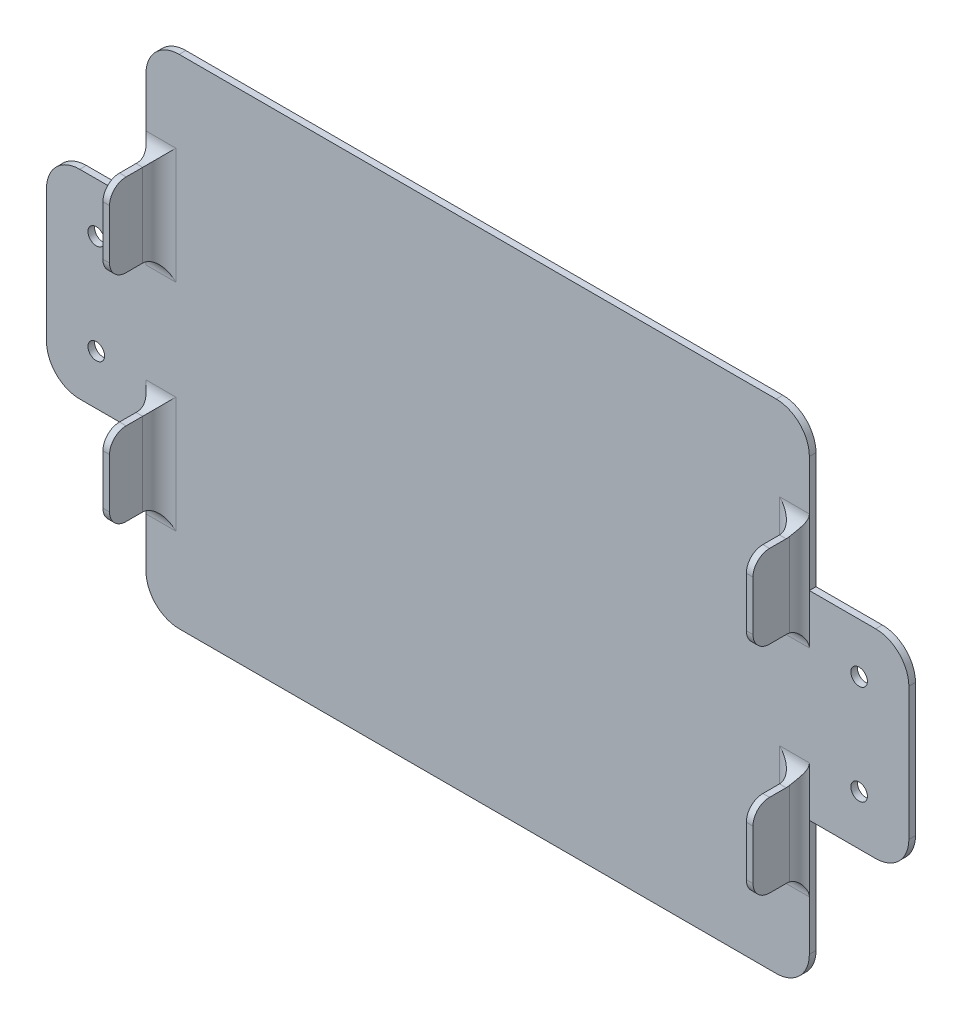
from build123d import *

# Parameters (mm, degrees)
ESQUISSE1_W             = 200
ESQUISSE1_H             = 150
BOSS_EXTRU_1_DEPTH      = 2
CONG_1_R                = 10
ESQUISSE2_W             = 2
ESQUISSE2_H             = 25
BOSS_EXTRU_2_DEPTH      = 15
CONG_2_R                = 5
ESQUISSE3_W             = 4.5
ESQUISSE3_H             = 30
ENL_V_MAT_EXTRU_1_DEPTH = 15
ESQUISSE4_R             = 2.5
BOSS_EXTRU_3_DEPTH      = 2


with BuildPart() as part:
    # Esquisse1 → Boss.-Extru.1 (new body)
    with BuildSketch(Plane.XY):
        with Locations((100, 75)):
            Rectangle(ESQUISSE1_W, ESQUISSE1_H)
    extrude(amount=BOSS_EXTRU_1_DEPTH)

    # Congé1
    cong_1_edges = [part.edges().sort_by_distance(p)[0] for p in [
        (0, 150, 1),
        (200, 150, 1),
        (200, 0, 1),
        (0, 0, 1),
    ]]
    fillet(cong_1_edges, radius=CONG_1_R)

    # Esquisse2 → Boss.-Extru.2 (add)
    with BuildSketch(Plane.XY.offset(2)):
        with Locations((3, 107.5)):
            Rectangle(ESQUISSE2_W, ESQUISSE2_H)
        with Locations((3, 42.5)):
            Rectangle(ESQUISSE2_W, ESQUISSE2_H)
        with Locations((197, 42.5)):
            Rectangle(ESQUISSE2_W, ESQUISSE2_H)
        with Locations((197, 107.5)):
            Rectangle(ESQUISSE2_W, ESQUISSE2_H)
    extrude(amount=BOSS_EXTRU_2_DEPTH)

    # Congé2
    # the kernel refuses this fillet: 5 mm, written as the material it adds along each edge
    with BuildSketch(Plane(origin=(2, 30, 2), x_dir=(-1, 0, 0), z_dir=(0, 1, 0)), Plane(origin=(2, 95, 2), x_dir=(-1, 0, 0), z_dir=(0, 1, 0))) as cong_2_piece_1:
        with BuildLine():
            CenterArc((5, 4), CONG_2_R, 180, 53.130102354)
            Line((0, 4), (0, 0))
            Line((0, 0), (2, 0))
        make_face()
    extrude(amount=25)
    with BuildSketch(Plane(origin=(4, 30, 2), x_dir=(0, -1, 0), z_dir=(-1, 0, 0)), Plane(origin=(2, 55, 2), x_dir=(0, 1, 0), z_dir=(1, 0, 0)), Plane(origin=(4, 95, 2), x_dir=(0, -1, 0), z_dir=(-1, 0, 0)), Plane(origin=(2, 120, 2), x_dir=(0, 1, 0), z_dir=(1, 0, 0))) as cong_2_piece_2:
        with BuildLine():
            CenterArc((CONG_2_R, CONG_2_R), CONG_2_R, 180, 90)
            Line((0, CONG_2_R), (0, 0))
            Line((0, 0), (CONG_2_R, 0))
        make_face()
    extrude(amount=2)
    with BuildSketch(Plane(origin=(4, 55, 2), x_dir=(1, 0, 0), z_dir=(0, -1, 0)), Plane(origin=(4, 120, 2), x_dir=(1, 0, 0), z_dir=(0, -1, 0))) as cong_2_piece_3:
        with BuildLine():
            CenterArc((CONG_2_R, CONG_2_R), CONG_2_R, 180, 90)
            Line((0, CONG_2_R), (0, 0))
            Line((0, 0), (CONG_2_R, 0))
        make_face()
    extrude(amount=25)
    with BuildSketch(Plane(origin=(198, 95, 2), x_dir=(1, 0, 0), z_dir=(0, 1, 0)), Plane(origin=(198, 30, 2), x_dir=(1, 0, 0), z_dir=(0, 1, 0))) as cong_2_piece_4:
        with BuildLine():
            CenterArc((5, -4), CONG_2_R, 126.869897646, 53.130102354)
            Line((0, -4), (0, 0))
            Line((0, 0), (2, 0))
        make_face()
    extrude(amount=25)
    with BuildSketch(Plane(origin=(198, 120, 2), x_dir=(0, 1, 0), z_dir=(-1, 0, 0)), Plane(origin=(196, 95, 2), x_dir=(0, -1, 0), z_dir=(1, 0, 0)), Plane(origin=(196, 30, 2), x_dir=(0, -1, 0), z_dir=(1, 0, 0)), Plane(origin=(198, 55, 2), x_dir=(0, 1, 0), z_dir=(-1, 0, 0))) as cong_2_piece_5:
        with BuildLine():
            CenterArc((CONG_2_R, -CONG_2_R), CONG_2_R, 90, 90)
            Line((0, -CONG_2_R), (0, 0))
            Line((0, 0), (CONG_2_R, 0))
        make_face()
    extrude(amount=2)
    with BuildSketch(Plane(origin=(196, 120, 2), x_dir=(-1, 0, 0), z_dir=(0, -1, 0)), Plane(origin=(196, 55, 2), x_dir=(-1, 0, 0), z_dir=(0, -1, 0))) as cong_2_piece_6:
        with BuildLine():
            CenterArc((CONG_2_R, -CONG_2_R), CONG_2_R, 90, 90)
            Line((0, -CONG_2_R), (0, 0))
            Line((0, 0), (CONG_2_R, 0))
        make_face()
    extrude(amount=25)
    with BuildSketch(Plane(origin=(2, 20, 2), x_dir=(-1, 0, 0), z_dir=(0, 1, 0))) as cong_2_piece_7a_section:
        with BuildLine():
            CenterArc((5, 4), CONG_2_R, 180, 53.130102354)
            Line((0, 4), (0, 0))
            Line((0, 0), (2, 0))
        make_face()
    cong_2_piece_7a = extrude(amount=35, mode=Mode.PRIVATE)
    cong_2_piece_7a = split(cong_2_piece_7a, bisect_by=Plane(origin=(2, 30, 2), z_dir=(0, -1, 0)), keep=Keep.TOP, mode=Mode.PRIVATE)
    with BuildSketch(Plane(origin=(4, 30, 2), x_dir=(0, -1, 0), z_dir=(-1, 0, 0))) as cong_2_piece_7b_section:
        with BuildLine():
            CenterArc((CONG_2_R, CONG_2_R), CONG_2_R, 180, 90)
            Line((0, CONG_2_R), (0, 0))
            Line((0, 0), (CONG_2_R, 0))
        make_face()
    cong_2_piece_7b = extrude(amount=14.5, mode=Mode.PRIVATE)
    cong_2_piece_7b = split(cong_2_piece_7b, bisect_by=Plane(origin=(0, 30, 2), z_dir=(1, 0, 0)), keep=Keep.TOP, mode=Mode.PRIVATE)
    cong_2_piece_7b = split(cong_2_piece_7b, bisect_by=Plane(origin=(2, 30, 2), z_dir=(-1, 0, 0)), keep=Keep.TOP, mode=Mode.PRIVATE)
    cong_2_piece_7 = cong_2_piece_7a & cong_2_piece_7b
    add(cong_2_piece_7)
    with BuildSketch(Plane(origin=(2, 30, 2), x_dir=(-1, 0, 0), z_dir=(0, 1, 0))) as cong_2_piece_8a_section:
        with BuildLine():
            CenterArc((5, 4), CONG_2_R, 180, 53.130102354)
            Line((0, 4), (0, 0))
            Line((0, 0), (2, 0))
        make_face()
    cong_2_piece_8a = extrude(amount=35, mode=Mode.PRIVATE)
    cong_2_piece_8a = split(cong_2_piece_8a, bisect_by=Plane(origin=(2, 55, 2), z_dir=(0, 1, 0)), keep=Keep.TOP, mode=Mode.PRIVATE)
    with BuildSketch(Plane(origin=(-10.5, 55, 2), x_dir=(0, 1, 0), z_dir=(1, 0, 0))) as cong_2_piece_8b_section:
        with BuildLine():
            CenterArc((CONG_2_R, CONG_2_R), CONG_2_R, 180, 90)
            Line((0, CONG_2_R), (0, 0))
            Line((0, 0), (CONG_2_R, 0))
        make_face()
    cong_2_piece_8b = extrude(amount=14.5, mode=Mode.PRIVATE)
    cong_2_piece_8b = split(cong_2_piece_8b, bisect_by=Plane(origin=(0, 55, 2), z_dir=(1, 0, 0)), keep=Keep.TOP, mode=Mode.PRIVATE)
    cong_2_piece_8b = split(cong_2_piece_8b, bisect_by=Plane(origin=(2, 55, 2), z_dir=(-1, 0, 0)), keep=Keep.TOP, mode=Mode.PRIVATE)
    cong_2_piece_8 = cong_2_piece_8a & cong_2_piece_8b
    add(cong_2_piece_8)
    with BuildSketch(Plane(origin=(16.5, 30, 2), x_dir=(0, -1, 0), z_dir=(-1, 0, 0))) as cong_2_piece_9a_section:
        with BuildLine():
            CenterArc((CONG_2_R, CONG_2_R), CONG_2_R, 180, 90)
            Line((0, CONG_2_R), (0, 0))
            Line((0, 0), (CONG_2_R, 0))
        make_face()
    cong_2_piece_9a = extrude(amount=14.5, mode=Mode.PRIVATE)
    cong_2_piece_9a = split(cong_2_piece_9a, bisect_by=Plane(origin=(4, 30, 2), z_dir=(1, 0, 0)), keep=Keep.TOP, mode=Mode.PRIVATE)
    with BuildSketch(Plane(origin=(4, 55, 2), x_dir=(1, 0, 0), z_dir=(0, -1, 0))) as cong_2_piece_9b_section:
        with BuildLine():
            CenterArc((CONG_2_R, CONG_2_R), CONG_2_R, 180, 90)
            Line((0, CONG_2_R), (0, 0))
            Line((0, 0), (CONG_2_R, 0))
        make_face()
    cong_2_piece_9b = extrude(amount=37.5, mode=Mode.PRIVATE)
    cong_2_piece_9b = split(cong_2_piece_9b, bisect_by=Plane(origin=(4, 30, 2), z_dir=(0, -1, 0)), keep=Keep.TOP, mode=Mode.PRIVATE)
    cong_2_piece_9 = cong_2_piece_9a & cong_2_piece_9b
    add(cong_2_piece_9)
    with BuildSketch(Plane(origin=(4, 67.5, 2), x_dir=(1, 0, 0), z_dir=(0, -1, 0))) as cong_2_piece_10a_section:
        with BuildLine():
            CenterArc((CONG_2_R, CONG_2_R), CONG_2_R, 180, 90)
            Line((0, CONG_2_R), (0, 0))
            Line((0, 0), (CONG_2_R, 0))
        make_face()
    cong_2_piece_10a = extrude(amount=37.5, mode=Mode.PRIVATE)
    cong_2_piece_10a = split(cong_2_piece_10a, bisect_by=Plane(origin=(4, 55, 2), z_dir=(0, 1, 0)), keep=Keep.TOP, mode=Mode.PRIVATE)
    with BuildSketch(Plane(origin=(2, 55, 2), x_dir=(0, 1, 0), z_dir=(1, 0, 0))) as cong_2_piece_10b_section:
        with BuildLine():
            CenterArc((CONG_2_R, CONG_2_R), CONG_2_R, 180, 90)
            Line((0, CONG_2_R), (0, 0))
            Line((0, 0), (CONG_2_R, 0))
        make_face()
    cong_2_piece_10b = extrude(amount=14.5, mode=Mode.PRIVATE)
    cong_2_piece_10b = split(cong_2_piece_10b, bisect_by=Plane(origin=(4, 55, 2), z_dir=(1, 0, 0)), keep=Keep.TOP, mode=Mode.PRIVATE)
    cong_2_piece_10 = cong_2_piece_10a & cong_2_piece_10b
    add(cong_2_piece_10)
    with BuildSketch(Plane(origin=(196, 95, 2), x_dir=(0, -1, 0), z_dir=(1, 0, 0))) as cong_2_piece_11a_section:
        with BuildLine():
            CenterArc((CONG_2_R, -CONG_2_R), CONG_2_R, 90, 90)
            Line((0, -CONG_2_R), (0, 0))
            Line((0, 0), (CONG_2_R, 0))
        make_face()
    cong_2_piece_11a = extrude(amount=14.5, mode=Mode.PRIVATE)
    cong_2_piece_11a = split(cong_2_piece_11a, bisect_by=Plane(origin=(200, 95, 2), z_dir=(-1, 0, 0)), keep=Keep.TOP, mode=Mode.PRIVATE)
    cong_2_piece_11a = split(cong_2_piece_11a, bisect_by=Plane(origin=(198, 95, 2), z_dir=(1, 0, 0)), keep=Keep.TOP, mode=Mode.PRIVATE)
    with BuildSketch(Plane(origin=(198, 85, 2), x_dir=(1, 0, 0), z_dir=(0, 1, 0))) as cong_2_piece_11b_section:
        with BuildLine():
            CenterArc((5, -4), CONG_2_R, 126.869897646, 53.130102354)
            Line((0, -4), (0, 0))
            Line((0, 0), (2, 0))
        make_face()
    cong_2_piece_11b = extrude(amount=35, mode=Mode.PRIVATE)
    cong_2_piece_11b = split(cong_2_piece_11b, bisect_by=Plane(origin=(198, 95, 2), z_dir=(0, -1, 0)), keep=Keep.TOP, mode=Mode.PRIVATE)
    cong_2_piece_11 = cong_2_piece_11a & cong_2_piece_11b
    add(cong_2_piece_11)
    with BuildSketch(Plane(origin=(198, 95, 2), x_dir=(1, 0, 0), z_dir=(0, 1, 0))) as cong_2_piece_12a_section:
        with BuildLine():
            CenterArc((5, -4), CONG_2_R, 126.869897646, 53.130102354)
            Line((0, -4), (0, 0))
            Line((0, 0), (2, 0))
        make_face()
    cong_2_piece_12a = extrude(amount=35, mode=Mode.PRIVATE)
    cong_2_piece_12a = split(cong_2_piece_12a, bisect_by=Plane(origin=(198, 120, 2), z_dir=(0, 1, 0)), keep=Keep.TOP, mode=Mode.PRIVATE)
    with BuildSketch(Plane(origin=(210.5, 120, 2), x_dir=(0, 1, 0), z_dir=(-1, 0, 0))) as cong_2_piece_12b_section:
        with BuildLine():
            CenterArc((CONG_2_R, -CONG_2_R), CONG_2_R, 90, 90)
            Line((0, -CONG_2_R), (0, 0))
            Line((0, 0), (CONG_2_R, 0))
        make_face()
    cong_2_piece_12b = extrude(amount=14.5, mode=Mode.PRIVATE)
    cong_2_piece_12b = split(cong_2_piece_12b, bisect_by=Plane(origin=(200, 120, 2), z_dir=(-1, 0, 0)), keep=Keep.TOP, mode=Mode.PRIVATE)
    cong_2_piece_12b = split(cong_2_piece_12b, bisect_by=Plane(origin=(198, 120, 2), z_dir=(1, 0, 0)), keep=Keep.TOP, mode=Mode.PRIVATE)
    cong_2_piece_12 = cong_2_piece_12a & cong_2_piece_12b
    add(cong_2_piece_12)
    with BuildSketch(Plane(origin=(196, 132.5, 2), x_dir=(-1, 0, 0), z_dir=(0, -1, 0))) as cong_2_piece_13a_section:
        with BuildLine():
            CenterArc((CONG_2_R, -CONG_2_R), CONG_2_R, 90, 90)
            Line((0, -CONG_2_R), (0, 0))
            Line((0, 0), (CONG_2_R, 0))
        make_face()
    cong_2_piece_13a = extrude(amount=37.5, mode=Mode.PRIVATE)
    cong_2_piece_13a = split(cong_2_piece_13a, bisect_by=Plane(origin=(196, 120, 2), z_dir=(0, 1, 0)), keep=Keep.TOP, mode=Mode.PRIVATE)
    with BuildSketch(Plane(origin=(198, 120, 2), x_dir=(0, 1, 0), z_dir=(-1, 0, 0))) as cong_2_piece_13b_section:
        with BuildLine():
            CenterArc((CONG_2_R, -CONG_2_R), CONG_2_R, 90, 90)
            Line((0, -CONG_2_R), (0, 0))
            Line((0, 0), (CONG_2_R, 0))
        make_face()
    cong_2_piece_13b = extrude(amount=14.5, mode=Mode.PRIVATE)
    cong_2_piece_13b = split(cong_2_piece_13b, bisect_by=Plane(origin=(196, 120, 2), z_dir=(-1, 0, 0)), keep=Keep.TOP, mode=Mode.PRIVATE)
    cong_2_piece_13 = cong_2_piece_13a & cong_2_piece_13b
    add(cong_2_piece_13)
    with BuildSketch(Plane(origin=(196, 120, 2), x_dir=(-1, 0, 0), z_dir=(0, -1, 0))) as cong_2_piece_14a_section:
        with BuildLine():
            CenterArc((CONG_2_R, -CONG_2_R), CONG_2_R, 90, 90)
            Line((0, -CONG_2_R), (0, 0))
            Line((0, 0), (CONG_2_R, 0))
        make_face()
    cong_2_piece_14a = extrude(amount=37.5, mode=Mode.PRIVATE)
    cong_2_piece_14a = split(cong_2_piece_14a, bisect_by=Plane(origin=(196, 95, 2), z_dir=(0, -1, 0)), keep=Keep.TOP, mode=Mode.PRIVATE)
    with BuildSketch(Plane(origin=(183.5, 95, 2), x_dir=(0, -1, 0), z_dir=(1, 0, 0))) as cong_2_piece_14b_section:
        with BuildLine():
            CenterArc((CONG_2_R, -CONG_2_R), CONG_2_R, 90, 90)
            Line((0, -CONG_2_R), (0, 0))
            Line((0, 0), (CONG_2_R, 0))
        make_face()
    cong_2_piece_14b = extrude(amount=14.5, mode=Mode.PRIVATE)
    cong_2_piece_14b = split(cong_2_piece_14b, bisect_by=Plane(origin=(196, 95, 2), z_dir=(-1, 0, 0)), keep=Keep.TOP, mode=Mode.PRIVATE)
    cong_2_piece_14 = cong_2_piece_14a & cong_2_piece_14b
    add(cong_2_piece_14)
    with BuildSketch(Plane(origin=(196, 55, 2), x_dir=(-1, 0, 0), z_dir=(0, -1, 0))) as cong_2_piece_15a_section:
        with BuildLine():
            CenterArc((CONG_2_R, -CONG_2_R), CONG_2_R, 90, 90)
            Line((0, -CONG_2_R), (0, 0))
            Line((0, 0), (CONG_2_R, 0))
        make_face()
    cong_2_piece_15a = extrude(amount=37.5, mode=Mode.PRIVATE)
    cong_2_piece_15a = split(cong_2_piece_15a, bisect_by=Plane(origin=(196, 30, 2), z_dir=(0, -1, 0)), keep=Keep.TOP, mode=Mode.PRIVATE)
    with BuildSketch(Plane(origin=(183.5, 30, 2), x_dir=(0, -1, 0), z_dir=(1, 0, 0))) as cong_2_piece_15b_section:
        with BuildLine():
            CenterArc((CONG_2_R, -CONG_2_R), CONG_2_R, 90, 90)
            Line((0, -CONG_2_R), (0, 0))
            Line((0, 0), (CONG_2_R, 0))
        make_face()
    cong_2_piece_15b = extrude(amount=14.5, mode=Mode.PRIVATE)
    cong_2_piece_15b = split(cong_2_piece_15b, bisect_by=Plane(origin=(196, 30, 2), z_dir=(-1, 0, 0)), keep=Keep.TOP, mode=Mode.PRIVATE)
    cong_2_piece_15 = cong_2_piece_15a & cong_2_piece_15b
    add(cong_2_piece_15)
    with BuildSketch(Plane(origin=(198, 20, 2), x_dir=(1, 0, 0), z_dir=(0, 1, 0))) as cong_2_piece_16a_section:
        with BuildLine():
            CenterArc((5, -4), CONG_2_R, 126.869897646, 53.130102354)
            Line((0, -4), (0, 0))
            Line((0, 0), (2, 0))
        make_face()
    cong_2_piece_16a = extrude(amount=35, mode=Mode.PRIVATE)
    cong_2_piece_16a = split(cong_2_piece_16a, bisect_by=Plane(origin=(198, 30, 2), z_dir=(0, -1, 0)), keep=Keep.TOP, mode=Mode.PRIVATE)
    with BuildSketch(Plane(origin=(196, 30, 2), x_dir=(0, -1, 0), z_dir=(1, 0, 0))) as cong_2_piece_16b_section:
        with BuildLine():
            CenterArc((CONG_2_R, -CONG_2_R), CONG_2_R, 90, 90)
            Line((0, -CONG_2_R), (0, 0))
            Line((0, 0), (CONG_2_R, 0))
        make_face()
    cong_2_piece_16b = extrude(amount=14.5, mode=Mode.PRIVATE)
    cong_2_piece_16b = split(cong_2_piece_16b, bisect_by=Plane(origin=(200, 30, 2), z_dir=(-1, 0, 0)), keep=Keep.TOP, mode=Mode.PRIVATE)
    cong_2_piece_16b = split(cong_2_piece_16b, bisect_by=Plane(origin=(198, 30, 2), z_dir=(1, 0, 0)), keep=Keep.TOP, mode=Mode.PRIVATE)
    cong_2_piece_16 = cong_2_piece_16a & cong_2_piece_16b
    add(cong_2_piece_16)
    with BuildSketch(Plane(origin=(198, 30, 2), x_dir=(1, 0, 0), z_dir=(0, 1, 0))) as cong_2_piece_17a_section:
        with BuildLine():
            CenterArc((5, -4), CONG_2_R, 126.869897646, 53.130102354)
            Line((0, -4), (0, 0))
            Line((0, 0), (2, 0))
        make_face()
    cong_2_piece_17a = extrude(amount=35, mode=Mode.PRIVATE)
    cong_2_piece_17a = split(cong_2_piece_17a, bisect_by=Plane(origin=(198, 55, 2), z_dir=(0, 1, 0)), keep=Keep.TOP, mode=Mode.PRIVATE)
    with BuildSketch(Plane(origin=(210.5, 55, 2), x_dir=(0, 1, 0), z_dir=(-1, 0, 0))) as cong_2_piece_17b_section:
        with BuildLine():
            CenterArc((CONG_2_R, -CONG_2_R), CONG_2_R, 90, 90)
            Line((0, -CONG_2_R), (0, 0))
            Line((0, 0), (CONG_2_R, 0))
        make_face()
    cong_2_piece_17b = extrude(amount=14.5, mode=Mode.PRIVATE)
    cong_2_piece_17b = split(cong_2_piece_17b, bisect_by=Plane(origin=(200, 55, 2), z_dir=(-1, 0, 0)), keep=Keep.TOP, mode=Mode.PRIVATE)
    cong_2_piece_17b = split(cong_2_piece_17b, bisect_by=Plane(origin=(198, 55, 2), z_dir=(1, 0, 0)), keep=Keep.TOP, mode=Mode.PRIVATE)
    cong_2_piece_17 = cong_2_piece_17a & cong_2_piece_17b
    add(cong_2_piece_17)
    with BuildSketch(Plane(origin=(198, 55, 2), x_dir=(0, 1, 0), z_dir=(-1, 0, 0))) as cong_2_piece_18a_section:
        with BuildLine():
            CenterArc((CONG_2_R, -CONG_2_R), CONG_2_R, 90, 90)
            Line((0, -CONG_2_R), (0, 0))
            Line((0, 0), (CONG_2_R, 0))
        make_face()
    cong_2_piece_18a = extrude(amount=14.5, mode=Mode.PRIVATE)
    cong_2_piece_18a = split(cong_2_piece_18a, bisect_by=Plane(origin=(196, 55, 2), z_dir=(-1, 0, 0)), keep=Keep.TOP, mode=Mode.PRIVATE)
    with BuildSketch(Plane(origin=(196, 67.5, 2), x_dir=(-1, 0, 0), z_dir=(0, -1, 0))) as cong_2_piece_18b_section:
        with BuildLine():
            CenterArc((CONG_2_R, -CONG_2_R), CONG_2_R, 90, 90)
            Line((0, -CONG_2_R), (0, 0))
            Line((0, 0), (CONG_2_R, 0))
        make_face()
    cong_2_piece_18b = extrude(amount=37.5, mode=Mode.PRIVATE)
    cong_2_piece_18b = split(cong_2_piece_18b, bisect_by=Plane(origin=(196, 55, 2), z_dir=(0, 1, 0)), keep=Keep.TOP, mode=Mode.PRIVATE)
    cong_2_piece_18 = cong_2_piece_18a & cong_2_piece_18b
    add(cong_2_piece_18)
    with BuildSketch(Plane(origin=(2, 85, 2), x_dir=(-1, 0, 0), z_dir=(0, 1, 0))) as cong_2_piece_19a_section:
        with BuildLine():
            CenterArc((5, 4), CONG_2_R, 180, 53.130102354)
            Line((0, 4), (0, 0))
            Line((0, 0), (2, 0))
        make_face()
    cong_2_piece_19a = extrude(amount=35, mode=Mode.PRIVATE)
    cong_2_piece_19a = split(cong_2_piece_19a, bisect_by=Plane(origin=(2, 95, 2), z_dir=(0, -1, 0)), keep=Keep.TOP, mode=Mode.PRIVATE)
    with BuildSketch(Plane(origin=(4, 95, 2), x_dir=(0, -1, 0), z_dir=(-1, 0, 0))) as cong_2_piece_19b_section:
        with BuildLine():
            CenterArc((CONG_2_R, CONG_2_R), CONG_2_R, 180, 90)
            Line((0, CONG_2_R), (0, 0))
            Line((0, 0), (CONG_2_R, 0))
        make_face()
    cong_2_piece_19b = extrude(amount=14.5, mode=Mode.PRIVATE)
    cong_2_piece_19b = split(cong_2_piece_19b, bisect_by=Plane(origin=(0, 95, 2), z_dir=(1, 0, 0)), keep=Keep.TOP, mode=Mode.PRIVATE)
    cong_2_piece_19b = split(cong_2_piece_19b, bisect_by=Plane(origin=(2, 95, 2), z_dir=(-1, 0, 0)), keep=Keep.TOP, mode=Mode.PRIVATE)
    cong_2_piece_19 = cong_2_piece_19a & cong_2_piece_19b
    add(cong_2_piece_19)
    with BuildSketch(Plane(origin=(2, 95, 2), x_dir=(-1, 0, 0), z_dir=(0, 1, 0))) as cong_2_piece_20a_section:
        with BuildLine():
            CenterArc((5, 4), CONG_2_R, 180, 53.130102354)
            Line((0, 4), (0, 0))
            Line((0, 0), (2, 0))
        make_face()
    cong_2_piece_20a = extrude(amount=35, mode=Mode.PRIVATE)
    cong_2_piece_20a = split(cong_2_piece_20a, bisect_by=Plane(origin=(2, 120, 2), z_dir=(0, 1, 0)), keep=Keep.TOP, mode=Mode.PRIVATE)
    with BuildSketch(Plane(origin=(-10.5, 120, 2), x_dir=(0, 1, 0), z_dir=(1, 0, 0))) as cong_2_piece_20b_section:
        with BuildLine():
            CenterArc((CONG_2_R, CONG_2_R), CONG_2_R, 180, 90)
            Line((0, CONG_2_R), (0, 0))
            Line((0, 0), (CONG_2_R, 0))
        make_face()
    cong_2_piece_20b = extrude(amount=14.5, mode=Mode.PRIVATE)
    cong_2_piece_20b = split(cong_2_piece_20b, bisect_by=Plane(origin=(0, 120, 2), z_dir=(1, 0, 0)), keep=Keep.TOP, mode=Mode.PRIVATE)
    cong_2_piece_20b = split(cong_2_piece_20b, bisect_by=Plane(origin=(2, 120, 2), z_dir=(-1, 0, 0)), keep=Keep.TOP, mode=Mode.PRIVATE)
    cong_2_piece_20 = cong_2_piece_20a & cong_2_piece_20b
    add(cong_2_piece_20)
    with BuildSketch(Plane(origin=(16.5, 95, 2), x_dir=(0, -1, 0), z_dir=(-1, 0, 0))) as cong_2_piece_21a_section:
        with BuildLine():
            CenterArc((CONG_2_R, CONG_2_R), CONG_2_R, 180, 90)
            Line((0, CONG_2_R), (0, 0))
            Line((0, 0), (CONG_2_R, 0))
        make_face()
    cong_2_piece_21a = extrude(amount=14.5, mode=Mode.PRIVATE)
    cong_2_piece_21a = split(cong_2_piece_21a, bisect_by=Plane(origin=(4, 95, 2), z_dir=(1, 0, 0)), keep=Keep.TOP, mode=Mode.PRIVATE)
    with BuildSketch(Plane(origin=(4, 120, 2), x_dir=(1, 0, 0), z_dir=(0, -1, 0))) as cong_2_piece_21b_section:
        with BuildLine():
            CenterArc((CONG_2_R, CONG_2_R), CONG_2_R, 180, 90)
            Line((0, CONG_2_R), (0, 0))
            Line((0, 0), (CONG_2_R, 0))
        make_face()
    cong_2_piece_21b = extrude(amount=37.5, mode=Mode.PRIVATE)
    cong_2_piece_21b = split(cong_2_piece_21b, bisect_by=Plane(origin=(4, 95, 2), z_dir=(0, -1, 0)), keep=Keep.TOP, mode=Mode.PRIVATE)
    cong_2_piece_21 = cong_2_piece_21a & cong_2_piece_21b
    add(cong_2_piece_21)
    with BuildSketch(Plane(origin=(4, 132.5, 2), x_dir=(1, 0, 0), z_dir=(0, -1, 0))) as cong_2_piece_22a_section:
        with BuildLine():
            CenterArc((CONG_2_R, CONG_2_R), CONG_2_R, 180, 90)
            Line((0, CONG_2_R), (0, 0))
            Line((0, 0), (CONG_2_R, 0))
        make_face()
    cong_2_piece_22a = extrude(amount=37.5, mode=Mode.PRIVATE)
    cong_2_piece_22a = split(cong_2_piece_22a, bisect_by=Plane(origin=(4, 120, 2), z_dir=(0, 1, 0)), keep=Keep.TOP, mode=Mode.PRIVATE)
    with BuildSketch(Plane(origin=(2, 120, 2), x_dir=(0, 1, 0), z_dir=(1, 0, 0))) as cong_2_piece_22b_section:
        with BuildLine():
            CenterArc((CONG_2_R, CONG_2_R), CONG_2_R, 180, 90)
            Line((0, CONG_2_R), (0, 0))
            Line((0, 0), (CONG_2_R, 0))
        make_face()
    cong_2_piece_22b = extrude(amount=14.5, mode=Mode.PRIVATE)
    cong_2_piece_22b = split(cong_2_piece_22b, bisect_by=Plane(origin=(4, 120, 2), z_dir=(1, 0, 0)), keep=Keep.TOP, mode=Mode.PRIVATE)
    cong_2_piece_22 = cong_2_piece_22a & cong_2_piece_22b
    add(cong_2_piece_22)
    # the kernel refuses this fillet: 5 mm, written as the material it takes off along each edge
    with BuildSketch(Plane(origin=(16.5, 30, 17), x_dir=(0, 0, -1), z_dir=(-1, 0, 0)), Plane(origin=(-10.5, 55, 17), x_dir=(0, 0, -1), z_dir=(1, 0, 0)), Plane(origin=(210.5, 120, 17), x_dir=(0, -1, 0), z_dir=(-1, 0, 0)), Plane(origin=(183.5, 95, 17), x_dir=(0, 1, 0), z_dir=(1, 0, 0)), Plane(origin=(183.5, 30, 17), x_dir=(0, 1, 0), z_dir=(1, 0, 0)), Plane(origin=(210.5, 55, 17), x_dir=(0, -1, 0), z_dir=(-1, 0, 0)), Plane(origin=(16.5, 95, 17), x_dir=(0, 0, -1), z_dir=(-1, 0, 0)), Plane(origin=(-10.5, 120, 17), x_dir=(0, 0, -1), z_dir=(1, 0, 0))) as cong_2_2_piece_1:
        with BuildLine():
            CenterArc((CONG_2_R, -CONG_2_R), CONG_2_R, 90, 90)
            Line((0, -CONG_2_R), (0, 0))
            Line((0, 0), (CONG_2_R, 0))
        make_face()
    extrude(amount=27, mode=Mode.SUBTRACT)

    # Esquisse3 → Enlèv. mat.-Extru.1 (cut)
    with BuildSketch(Plane.XY.offset(2)):
        with Locations((2.25, 75)):
            Rectangle(ESQUISSE3_W, ESQUISSE3_H)
        with Locations((197.75, 75)):
            Rectangle(ESQUISSE3_W, ESQUISSE3_H)
    extrude(amount=-ENL_V_MAT_EXTRU_1_DEPTH, mode=Mode.SUBTRACT)

    # Esquisse4 → Boss.-Extru.3 (add)
    # profile 1 of 2: a face of its own
    with BuildSketch(Plane(origin=(0, 0, 0), x_dir=(-1, 0, 0), z_dir=(0, 0, -1))):
        with BuildLine():
            Line((-20, 105), (20, 105))
            ThreePointArc((20, 105), (27.071067812, 102.071067812), (30, 95))
            Line((30, 95), (30, 55))
            ThreePointArc((30, 55), (27.071067812, 47.928932188), (20, 45))
            Line((20, 45), (-20, 45))
            Line((-20, 45), (-20, 105))
        make_face()
        with Locations((15, 90)):
            Circle(ESQUISSE4_R, mode=Mode.SUBTRACT)
        with Locations((15, 60)):
            Circle(ESQUISSE4_R, mode=Mode.SUBTRACT)
    # profile 2 of 2: a face of its own
    with BuildSketch(Plane(origin=(0, 0, 0), x_dir=(-1, 0, 0), z_dir=(0, 0, -1))):
        with BuildLine():
            Line((-180, 45), (-220, 45))
            ThreePointArc((-220, 45), (-227.071067812, 47.928932188), (-230, 55))
            Line((-230, 55), (-230, 95))
            ThreePointArc((-230, 95), (-227.071067812, 102.071067812), (-220, 105))
            Line((-220, 105), (-180, 105))
            Line((-180, 105), (-180, 45))
        make_face()
        with Locations(Location((-215, 60, 0), (0, 0, 180))):
            Circle(ESQUISSE4_R, mode=Mode.SUBTRACT)
        with Locations(Location((-215, 90, 0), (0, 0, 180))):
            Circle(ESQUISSE4_R, mode=Mode.SUBTRACT)
    extrude(amount=-BOSS_EXTRU_3_DEPTH)


solid = part.part
